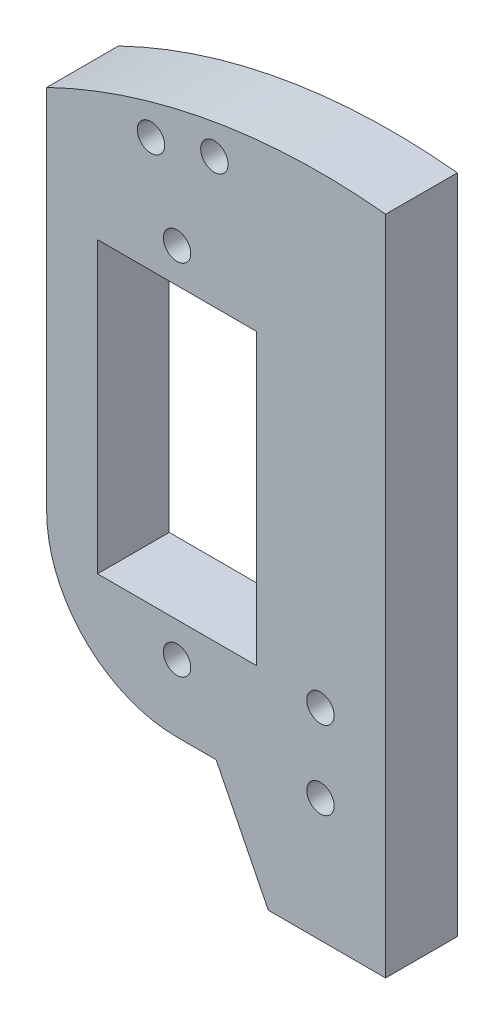
from build123d import *

# Parameters (mm, degrees)
SKETCH_1_R          = 1.05
SKETCH_1_W          = 12.2
SKETCH_1_H          = 22.2
EXTRUDE_1_DEPTH     = 5.5
CUT_EXTRUDE_1_DEPTH = 32.778294479
FILLET_1_R          = 10
SKETCH_4_R          = 1.05
CUT_EXTRUDE_2_DEPTH = 32.778294479


with BuildPart() as part:
    # ｽｹｯﾁ1 → ﾎﾞｽ - 押し出し1 (new body)
    with BuildSketch(Plane.XY):
        Polygon((-10, -18.9), (3, -18.9), (7, -26.9), (16, -26.9), (16, 26.1), (-10, 26.1), align=None)
        with Locations((0, -13.75)):
            Circle(SKETCH_1_R, mode=Mode.SUBTRACT)
        with Locations((0, 13.75)):
            Circle(SKETCH_1_R, mode=Mode.SUBTRACT)
        with Locations((11, -17.45)):
            Circle(SKETCH_1_R, mode=Mode.SUBTRACT)
        with Locations((11, -11.45)):
            Circle(SKETCH_1_R, mode=Mode.SUBTRACT)
        Rectangle(SKETCH_1_W, SKETCH_1_H, mode=Mode.SUBTRACT)
    extrude(amount=EXTRUDE_1_DEPTH)

    # ｽｹｯﾁ2 → ｶｯﾄ - 押し出し1 (cut, through all)
    with BuildSketch(Plane.XY.offset(5.5)):
        with BuildLine():
            Line((-10, 19.26248371), (-10, 26.1))
            Line((-10, 26.1), (16, 26.1))
            Line((16, 26.1), (16, 23.838873049))
            ThreePointArc((16, 23.838873049), (2.679192657, 23.373292303), (-10, 19.26248371))
        make_face()
    extrude(amount=-CUT_EXTRUDE_1_DEPTH, mode=Mode.SUBTRACT)

    # ﾌｨﾚｯﾄ1
    fillet_1_edges = [part.edges().sort_by_distance(p)[0] for p in [
        (-10, -18.9, 2.75),
    ]]
    fillet(fillet_1_edges, radius=FILLET_1_R)

    # ｽｹｯﾁ4 → ｶｯﾄ - 押し出し2 (cut, through all)
    with BuildSketch(Plane.XY.offset(5.5)):
        with Locations((-2, 19.942793261)):
            Circle(SKETCH_4_R)
        with Locations((2.864244295, 21.1)):
            Circle(SKETCH_4_R)
    extrude(amount=-CUT_EXTRUDE_2_DEPTH, mode=Mode.SUBTRACT)


solid = part.part
